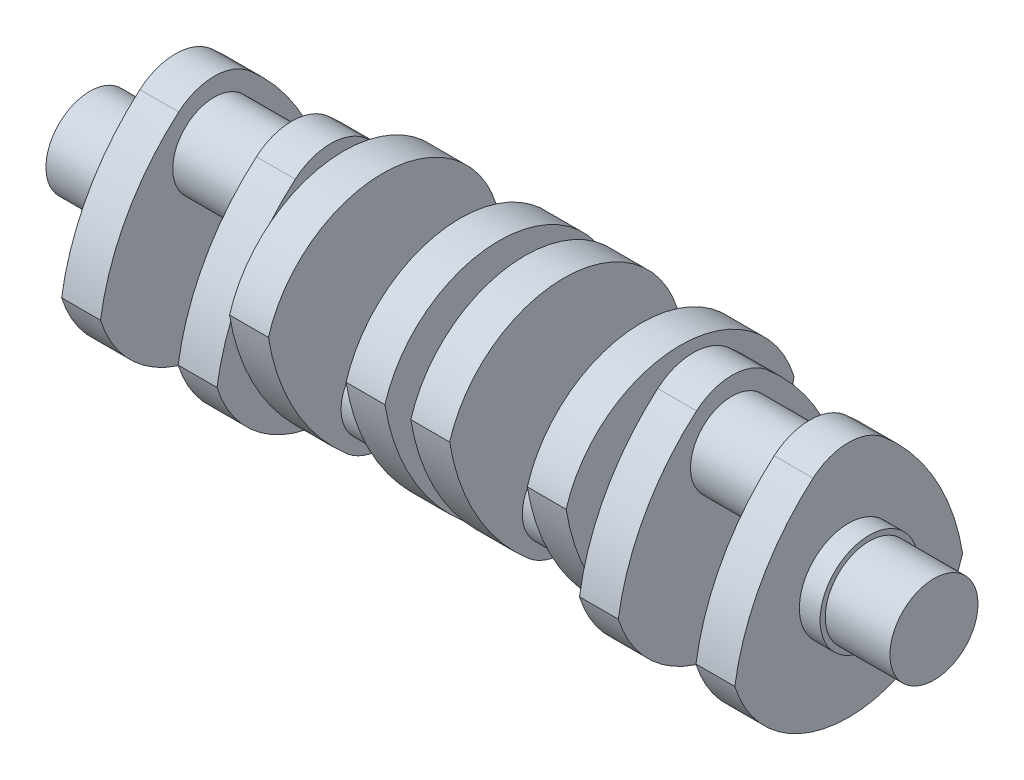
from build123d import *

# Parameters (mm, degrees)
SKETCH1_R            = 17
BOSS_EXTRUDE3_DEPTH  = 25
SKETCH1_5_R          = 19
BOSS_EXTRUDE4_DEPTH  = 8
BOSS_EXTRUDE5_DEPTH  = 15
SKETCH3_R            = 16
BOSS_EXTRUDE6_DEPTH  = 15
MIRROR1_START        = 53
MIRROR1_DEPTH        = 15
MIRROR1_START_2      = 38
MIRROR1_2_OUTLINE_R  = 16
MIRROR1_2_DEPTH      = 15
BOSS_EXTRUDE7_START  = 5
SKETCH4_R            = 17
BOSS_EXTRUDE7_DEPTH  = 5
BOSS_EXTRUDE8_DEPTH  = 15
SKETCH6_R            = 16
BOSS_EXTRUDE9_DEPTH  = 30
BOSS_EXTRUDE10_DEPTH = 15
BOSS_EXTRUDE11_START = 5
SKETCH8_R            = 17
BOSS_EXTRUDE11_DEPTH = 5


# Read off the part's stored shape, not the designer's step: Mirror1
with BuildPart() as part:
    # Sketch1 → Boss-Extrude3 (new body)
    with BuildSketch(Plane(origin=(0, 0, 0), x_dir=(0, 0, -1), z_dir=(1, 0, 0))):
        Circle(SKETCH1_R)
    extrude(amount=-BOSS_EXTRUDE3_DEPTH)

    # Sketch1<5> → Boss-Extrude4 (add)
    with BuildSketch(Plane(origin=(0, 0, 0), x_dir=(0, 0, -1), z_dir=(1, 0, 0))):
        Circle(SKETCH1_5_R)
    extrude(amount=BOSS_EXTRUDE4_DEPTH)

    # Sketch2 → Boss-Extrude5 (add)
    with BuildSketch(Plane(origin=(8, 0, 0), x_dir=(0, 0, -1), z_dir=(1, 0, 0))):
        with BuildLine():
            ThreePointArc((-13.706014257, 40.910536546), (-0.050406066, 45.999939505), (13.629476778, 40.97614981))
            ThreePointArc((13.629476778, 40.97614981), (33.671459186, 16.608703248), (44.071795254, -13.178651794))
            ThreePointArc((44.071795254, -13.178651794), (0.246197834, -45.999341154), (-43.928204746, -13.649645701))
            ThreePointArc((-43.928204746, -13.649645701), (-33.694579877, 16.332192974), (-13.706014257, 40.910536546))
        make_face()
    extrude(amount=BOSS_EXTRUDE5_DEPTH)

    # Sketch3 → Boss-Extrude6 (add)
    with BuildSketch(Plane(origin=(23, 0, 0), x_dir=(0, 0, -1), z_dir=(1, 0, 0))):
        with Locations((-0.025203033, 22.999969753)):
            Circle(SKETCH3_R)
    extrude(amount=BOSS_EXTRUDE6_DEPTH)



with BuildPart() as body_2:
    # Mirror1 outline → Mirror1 (new body)
    with BuildSketch(Plane.YZ.offset(MIRROR1_START)):
        with BuildLine():
            ThreePointArc((40.97614981, -13.629476778), (45.999939505, 0.050406066), (40.910536546, 13.706014257))
            ThreePointArc((40.910536546, 13.706014257), (16.332192974, 33.694579877), (-13.649645701, 43.928204746))
            ThreePointArc((-13.649645701, 43.928204746), (-45.999341154, -0.246197834), (-13.178651794, -44.071795254))
            ThreePointArc((-13.178651794, -44.071795254), (16.608703248, -33.671459186), (40.97614981, -13.629476778))
        make_face()
    extrude(amount=MIRROR1_DEPTH)


with BuildPart() as part_1:
    add(part.part)

    add(body_2.part)  # Mirror1 2 merges body 2
    # Mirror1 2 outline → Mirror1 2 (add)
    with BuildSketch(Plane.YZ.offset(MIRROR1_START_2)):
        with Locations((22.999969753, 0.025203033)):
            Circle(MIRROR1_2_OUTLINE_R)
    extrude(amount=MIRROR1_2_DEPTH)

    # Sketch4 → Boss-Extrude7 (add)
    with BuildSketch(Plane(origin=(68, 0, 0), x_dir=(0, 0, -1), z_dir=(1, 0, 0)).offset(BOSS_EXTRUDE7_START)):
        Circle(SKETCH4_R)
    extrude(amount=-BOSS_EXTRUDE7_DEPTH)

    # Sketch5 → Boss-Extrude8 (add)
    with BuildSketch(Plane(origin=(73, 0, 0), x_dir=(0, 0, -1), z_dir=(1, 0, 0))):
        with BuildLine():
            ThreePointArc((-13.629476778, -40.97614981), (0.050406066, -45.999939505), (13.706014257, -40.910536546))
            ThreePointArc((13.706014257, -40.910536546), (33.694579877, -16.332192974), (43.928204746, 13.649645701))
            ThreePointArc((43.928204746, 13.649645701), (-0.246197834, 45.999341154), (-44.071795254, 13.178651794))
            ThreePointArc((-44.071795254, 13.178651794), (-33.671459186, -16.608703248), (-13.629476778, -40.97614981))
        make_face()
    extrude(amount=BOSS_EXTRUDE8_DEPTH)

    # Sketch6 → Boss-Extrude9 (add)
    with BuildSketch(Plane(origin=(88, 0, 0), x_dir=(0, 0, -1), z_dir=(1, 0, 0))):
        with Locations((0, -25)):
            Circle(SKETCH6_R)
    extrude(amount=BOSS_EXTRUDE9_DEPTH)

    # Sketch7 → Boss-Extrude10 (add)
    with BuildSketch(Plane(origin=(118, 0, 0), x_dir=(0, 0, -1), z_dir=(1, 0, 0))):
        with BuildLine():
            ThreePointArc((-13.629476778, -40.97614981), (0.050406066, -45.999939505), (13.706014257, -40.910536546))
            ThreePointArc((13.706014257, -40.910536546), (33.694579877, -16.332192974), (43.928204746, 13.649645701))
            ThreePointArc((43.928204746, 13.649645701), (-0.246197834, 45.999341154), (-44.071795254, 13.178651794))
            ThreePointArc((-44.071795254, 13.178651794), (-33.671459186, -16.608703248), (-13.629476778, -40.97614981))
        make_face()
    extrude(amount=BOSS_EXTRUDE10_DEPTH)

    # Sketch8 → Boss-Extrude11 (add)
    with BuildSketch(Plane(origin=(133, 0, 0), x_dir=(0, 0, -1), z_dir=(1, 0, 0)).offset(BOSS_EXTRUDE11_START)):
        Circle(SKETCH8_R)
    extrude(amount=-BOSS_EXTRUDE11_DEPTH)

    # Mirror2: part across plane


with BuildPart() as part_2:
    add(part_1.part)
    add(part_1.part.mirror(Plane(origin=(138, 0, 0), x_dir=(0, 0, 1), z_dir=(1, 0, 0))))


solid = part_2.part
